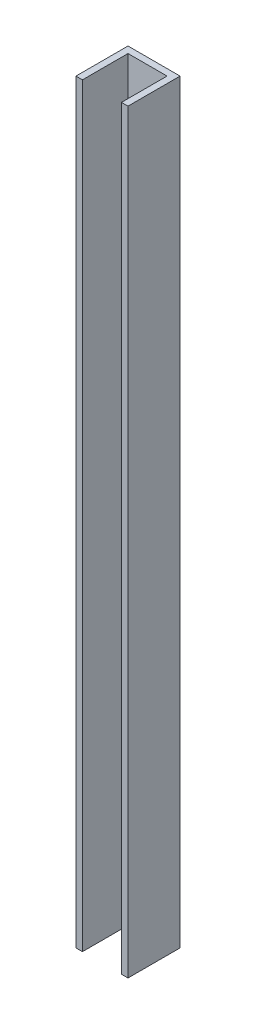
from build123d import *

# Parameters (mm, degrees)
BOSS_EXTRUDE1_DEPTH = 368.3


with BuildPart() as part:
    # Sketch1 → Boss-Extrude1 (new body)
    with BuildSketch(Plane(origin=(0, 0, 0), x_dir=(1, 0, 0), z_dir=(0, 1, 0))):
        Polygon((0, 0), (3.175, 0), (3.175, 22.225), (22.225, 22.225), (22.225, 0), (25.4, 0), (25.4, 25.4), (0, 25.4), align=None)
    extrude(amount=BOSS_EXTRUDE1_DEPTH)


solid = part.part
